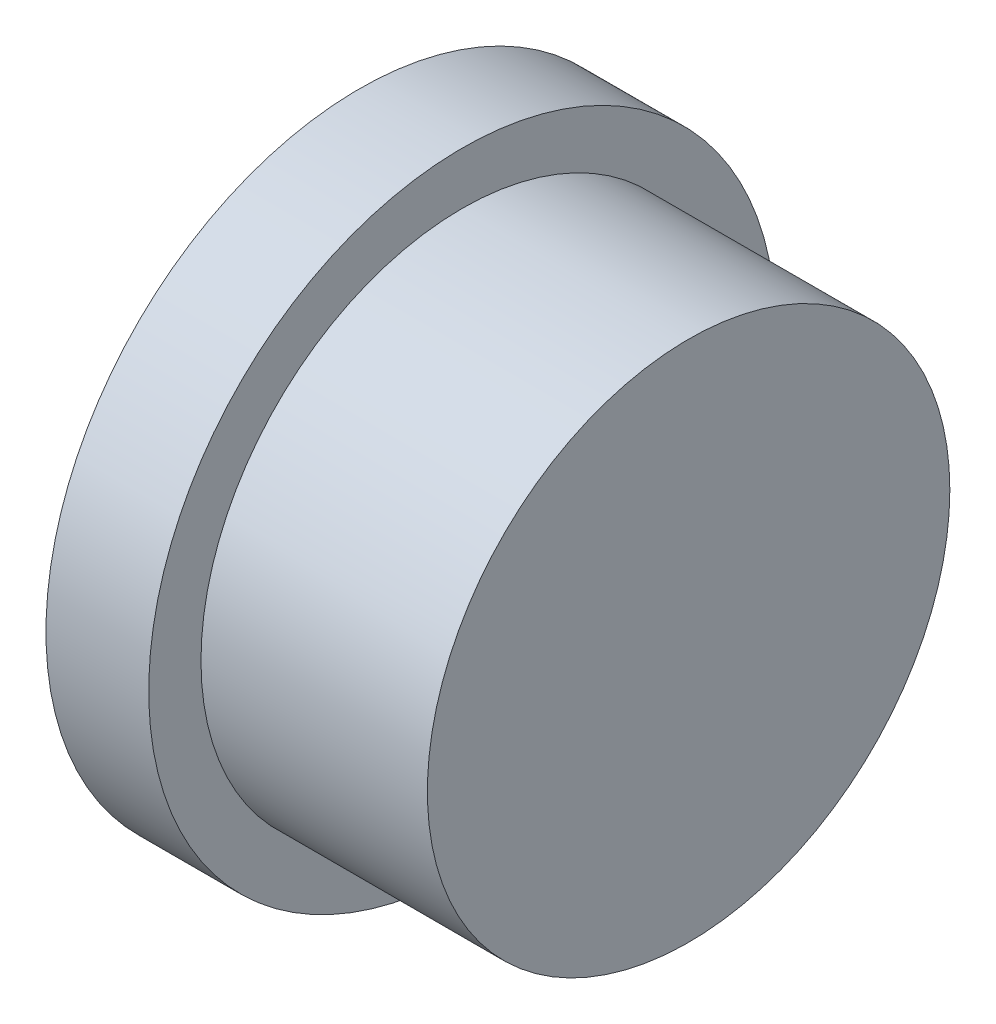
from build123d import *

# Parameters (mm, degrees)
SPUR_START             = 15.199213342
SPUR_GEAR_AM_OUTLINE_R = 1.5
SPUR_GEAR_AM_DEPTH     = 12
SKETCH9_R              = 1.5
BOSS_EXTRUDE1_DEPTH    = 12
SKETCH10_R             = 2.874
BOSS_EXTRUDE2_DEPTH    = 10
SKETCH11_R             = 15
BOSS_EXTRUDE3_DEPTH    = 1
SKETCH12_R             = 15
SKETCH12_R_2           = 13.5
BOSS_EXTRUDE4_DEPTH    = 13
SKETCH13_R             = 18
SKETCH13_R_2           = 13.5
BOSS_EXTRUDE5_DEPTH    = 1.9
SKETCH14_R             = 18
SKETCH14_R_2           = 16.075
BOSS_EXTRUDE6_DEPTH    = 4
SKETCH17_R             = 4
CUT_EXTRUDE2_DEPTH     = 41.416963439
SKETCH19_R             = 2.874
BOSS_EXTRUDE7_DEPTH    = 10


# Read off the part's stored shape, not the designer's step: spur gear_am
with BuildPart() as part:
    # spur gear_am outline → spur gear_am (new body)
    with BuildSketch(Plane.YZ.offset(SPUR_START)):
        with BuildLine():
            ThreePointArc((2.747947228, -4.643773619), (2.654088149, -4.687486435), (2.561391914, -4.733613923))
            ThreePointArc((2.561391914, -4.733613923), (2.561783739, -5.337982285), (2.816889806, -5.88587111))
            ThreePointArc((2.816889806, -5.88587111), (2.597713415, -6.044378226), (2.394409068, -6.222788256))
            ThreePointArc((2.394409068, -6.222788256), (1.9170234, -5.852161498), (1.327895004, -5.717294884))
            ThreePointArc((1.327895004, -5.717294884), (1.262297175, -5.797402699), (1.198794721, -5.879181519))
            ThreePointArc((1.198794721, -5.879181519), (1.461373347, -6.423528591), (1.928936024, -6.806472991))
            ThreePointArc((1.928936024, -6.806472991), (1.800238579, -7.04438004), (1.694476903, -7.293332374))
            ThreePointArc((1.694476903, -7.293332374), (1.103558354, -7.166539081), (0.514255579, -7.300641692))
            ThreePointArc((0.514255579, -7.300641692), (0.489911456, -7.401278171), (0.468180222, -7.502511024))
            ThreePointArc((0.468180222, -7.502511024), (0.940938733, -7.879022193), (1.528351497, -8.021175333))
            ThreePointArc((1.528351497, -8.021175333), (1.515623105, -8.291361907), (1.528351497, -8.56154848))
            ThreePointArc((1.528351497, -8.56154848), (0.940938733, -8.70370162), (0.468180222, -9.080212789))
            ThreePointArc((0.468180222, -9.080212789), (0.489911456, -9.181445642), (0.514255579, -9.28208212))
            ThreePointArc((0.514255579, -9.28208212), (1.103558354, -9.416184732), (1.694476903, -9.289391439))
            ThreePointArc((1.694476903, -9.289391439), (1.800238579, -9.538343772), (1.928936024, -9.776250821))
            ThreePointArc((1.928936024, -9.776250821), (1.461373347, -10.159195221), (1.198794721, -10.703542294))
            ThreePointArc((1.198794721, -10.703542294), (1.262297175, -10.785321114), (1.327895004, -10.865428928))
            ThreePointArc((1.327895004, -10.865428928), (1.9170234, -10.730562315), (2.394409068, -10.359935556))
            ThreePointArc((2.394409068, -10.359935556), (2.597713414, -10.538345587), (2.816889806, -10.696852703))
            ThreePointArc((2.816889806, -10.696852703), (2.561783739, -11.244741528), (2.561391914, -11.84910989))
            ThreePointArc((2.561391914, -11.84910989), (2.654088149, -11.895237378), (2.747947228, -11.938950194))
            ThreePointArc((2.747947228, -11.938950194), (3.220217142, -11.561826343), (3.489517843, -11.020773293))
            ThreePointArc((3.489517843, -11.020773293), (3.750097941, -11.093304726), (4.016342706, -11.14101763))
            ThreePointArc((4.016342706, -11.14101763), (4.024220134, -11.745334779), (4.286092716, -12.290021864))
            ThreePointArc((4.286092716, -12.290021864), (4.389623105, -12.291361906), (4.493153494, -12.290021864))
            ThreePointArc((4.493153494, -12.290021864), (4.755026076, -11.745334779), (4.762903504, -11.14101763))
            ThreePointArc((4.762903504, -11.14101763), (5.029148269, -11.093304726), (5.289728367, -11.020773293))
            ThreePointArc((5.289728367, -11.020773293), (5.559029068, -11.561826343), (6.031298982, -11.938950194))
            ThreePointArc((6.031298982, -11.938950194), (6.125158061, -11.895237378), (6.217854296, -11.84910989))
            ThreePointArc((6.217854296, -11.84910989), (6.217462471, -11.244741528), (5.962356404, -10.696852703))
            ThreePointArc((5.962356404, -10.696852703), (6.181532796, -10.538345587), (6.384837142, -10.359935556))
            ThreePointArc((6.384837142, -10.359935556), (6.86222281, -10.730562315), (7.451351206, -10.865428928))
            ThreePointArc((7.451351206, -10.865428928), (7.516949035, -10.785321114), (7.580451489, -10.703542294))
            ThreePointArc((7.580451489, -10.703542294), (7.317872863, -10.159195221), (6.850310186, -9.776250821))
            ThreePointArc((6.850310186, -9.776250821), (6.979007631, -9.538343772), (7.084769307, -9.289391439))
            ThreePointArc((7.084769307, -9.289391439), (7.675687856, -9.416184732), (8.26499063, -9.28208212))
            ThreePointArc((8.26499063, -9.28208212), (8.289334754, -9.181445642), (8.311065988, -9.080212789))
            ThreePointArc((8.311065988, -9.080212789), (7.838307477, -8.70370162), (7.250894713, -8.56154848))
            ThreePointArc((7.250894713, -8.56154848), (7.263623105, -8.291361907), (7.250894713, -8.021175333))
            ThreePointArc((7.250894713, -8.021175333), (7.838307477, -7.879022193), (8.311065988, -7.502511024))
            ThreePointArc((8.311065988, -7.502511024), (8.289334754, -7.40127817), (8.26499063, -7.300641692))
            ThreePointArc((8.26499063, -7.300641692), (7.675687856, -7.166539081), (7.084769307, -7.293332374))
            ThreePointArc((7.084769307, -7.293332374), (6.979007631, -7.04438004), (6.850310186, -6.806472991))
            ThreePointArc((6.850310186, -6.806472991), (7.317872863, -6.423528591), (7.580451489, -5.879181519))
            ThreePointArc((7.580451489, -5.879181519), (7.516949035, -5.797402699), (7.451351206, -5.717294884))
            ThreePointArc((7.451351206, -5.717294884), (6.86222281, -5.852161498), (6.384837142, -6.222788256))
            ThreePointArc((6.384837142, -6.222788256), (6.181532795, -6.044378226), (5.962356404, -5.88587111))
            ThreePointArc((5.962356404, -5.88587111), (6.217462471, -5.337982285), (6.217854296, -4.733613923))
            ThreePointArc((6.217854296, -4.733613923), (6.125158061, -4.687486435), (6.031298982, -4.643773619))
            ThreePointArc((6.031298982, -4.643773619), (5.559029068, -5.02089747), (5.289728367, -5.56195052))
            ThreePointArc((5.289728367, -5.56195052), (5.029148269, -5.489419087), (4.762903504, -5.441706183))
            ThreePointArc((4.762903504, -5.441706183), (4.755026076, -4.837389034), (4.493153494, -4.292701948))
            ThreePointArc((4.493153494, -4.292701948), (4.389623105, -4.291361906), (4.286092716, -4.292701948))
            ThreePointArc((4.286092716, -4.292701948), (4.024220134, -4.837389034), (4.016342706, -5.441706183))
            ThreePointArc((4.016342706, -5.441706183), (3.750097941, -5.489419087), (3.489517843, -5.56195052))
            ThreePointArc((3.489517843, -5.56195052), (3.220217142, -5.02089747), (2.747947228, -4.643773619))
        make_face()
        with Locations((4.389623105, -8.291361906)):
            Circle(SPUR_GEAR_AM_OUTLINE_R, mode=Mode.SUBTRACT)
    extrude(amount=SPUR_GEAR_AM_DEPTH)

    # Sketch9 → Boss-Extrude1 (add, through all)
    with BuildSketch(Plane(origin=(27.199213342, 0, 0), x_dir=(0, 0, -1), z_dir=(1, 0, 0))):
        with Locations((8.291361906, 4.389623105)):
            Circle(SKETCH9_R)
    extrude(amount=-BOSS_EXTRUDE1_DEPTH)

    # Sketch10 → Boss-Extrude2 (add)
    with BuildSketch(Plane(origin=(27.199213342, 0, 0), x_dir=(0, 0, -1), z_dir=(1, 0, 0))):
        with Locations(Location((8.291361906, 4.389623105, 0), (0, 0, 172.537235833))):
            Circle(SKETCH10_R)
    extrude(amount=BOSS_EXTRUDE2_DEPTH)

    # Sketch11 → Boss-Extrude3 (add)
    with BuildSketch(Plane(origin=(37.199213342, 0, 0), x_dir=(0, 0, -1), z_dir=(1, 0, 0))):
        with Locations((8.291361906, 4.389623105)):
            Circle(SKETCH11_R)
    extrude(amount=-BOSS_EXTRUDE3_DEPTH)

    # Sketch12 → Boss-Extrude4 (add)
    with BuildSketch(Plane.ZY.offset(-37.199213342)):
        with Locations(Location((-8.291361906, 4.389623105, 0), (0, 0, 180))):
            Circle(SKETCH12_R)
        with Locations(Location((-8.291361906, 4.389623105, 0), (0, 0, 180))):
            Circle(SKETCH12_R_2, mode=Mode.SUBTRACT)
    extrude(amount=BOSS_EXTRUDE4_DEPTH)

    # Sketch13 → Boss-Extrude5 (add)
    with BuildSketch(Plane.ZY.offset(-24.199213342)):
        with Locations(Location((-8.291361906, 4.389623105, 0), (0, 0, 180))):
            Circle(SKETCH13_R)
        with Locations(Location((-8.291361906, 4.389623105, 0), (0, 0, 180))):
            Circle(SKETCH13_R_2, mode=Mode.SUBTRACT)
    extrude(amount=BOSS_EXTRUDE5_DEPTH)

    # Sketch14 → Boss-Extrude6 (add)
    with BuildSketch(Plane.ZY.offset(-22.299213342)):
        with Locations(Location((-8.291361906, 4.389623105, 0), (0, 0, 180))):
            Circle(SKETCH14_R)
        with Locations((-8.291361906, 4.389623105)):
            Circle(SKETCH14_R_2, mode=Mode.SUBTRACT)
    extrude(amount=BOSS_EXTRUDE6_DEPTH)

    # Sketch17 → Cut-Extrude2 (cut, through all)
    with BuildSketch(Plane.ZY.offset(-36.199213342)):
        with Locations((-8.291361906, 4.389623105)):
            Circle(SKETCH17_R)
    extrude(amount=CUT_EXTRUDE2_DEPTH, mode=Mode.SUBTRACT)

    # Sketch19 → Boss-Extrude7 (add)
    with BuildSketch(Plane.ZY.offset(-36.199213342)):
        with Locations(Location((-8.291361906, 4.389623105, 0), (0, 0, 180))):
            Circle(SKETCH19_R)
    extrude(amount=BOSS_EXTRUDE7_DEPTH)


solid = part.part
